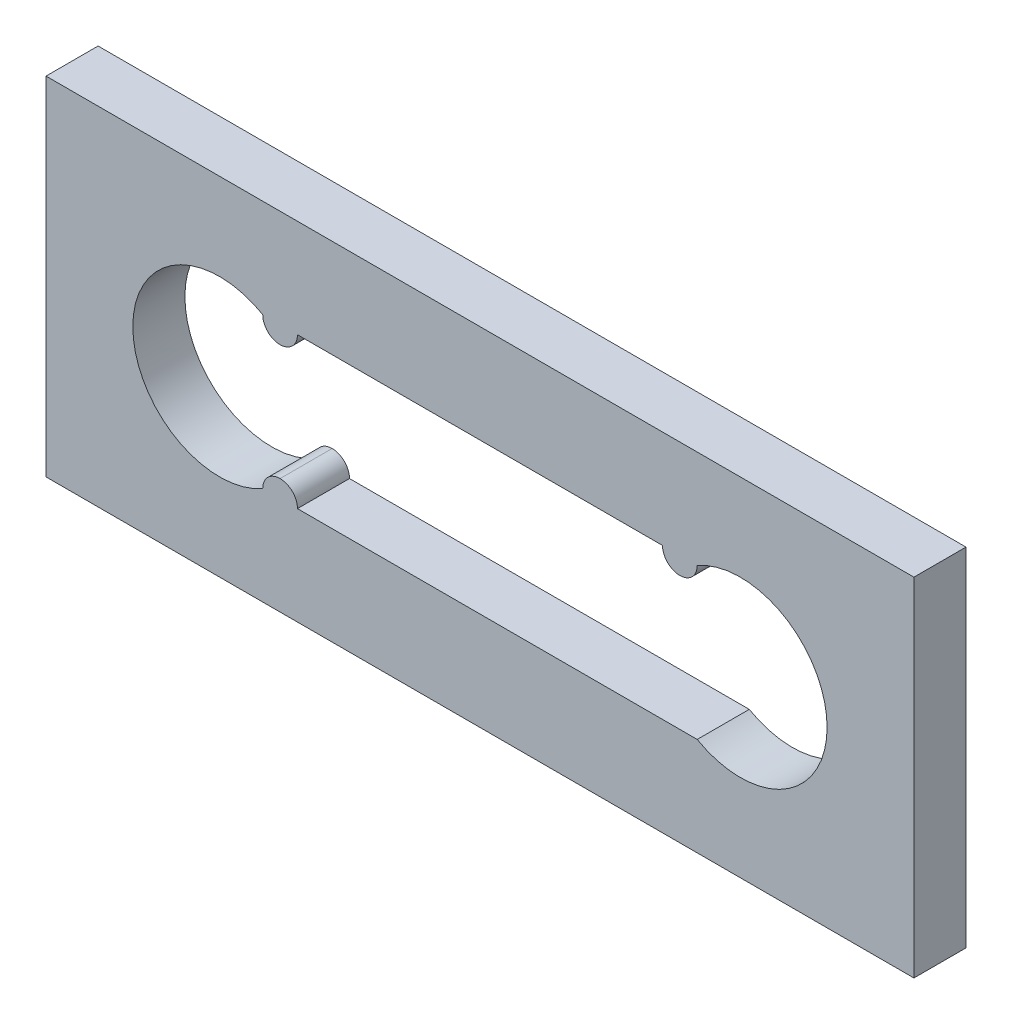
from build123d import *

# Parameters (mm, degrees)
SKETCH_1_W          = 50
SKETCH_1_H          = 20
EXTRUDE_1_DEPTH     = 3
SKETCH_3_R          = 5
SKETCH_3_W          = 30
SKETCH_3_H          = 8.678040074
CUT_EXTRUDE_1_DEPTH = 3
SKETCH_4_W          = 2
SKETCH_4_H          = 3
EXTRUDE_2_DEPTH     = 1
FILLET_1_R          = 1
SKETCH_5_W          = 2
SKETCH_5_H          = 3
EXTRUDE_3_DEPTH     = 1
FILLET_2_R          = 1


with BuildPart() as part:
    # 스케치1 → 보스-돌출1 (new body)
    with BuildSketch(Plane.XY):
        Rectangle(SKETCH_1_W, SKETCH_1_H)
    extrude(amount=-EXTRUDE_1_DEPTH)

    # 스케치3 → 컷-돌출1 (cut)
    with BuildSketch(Plane.XY):
        with Locations((-15, 0)):
            Circle(SKETCH_3_R)
        with Locations((15, 0)):
            Circle(SKETCH_3_R)
        Rectangle(SKETCH_3_W, SKETCH_3_H)
    extrude(amount=-CUT_EXTRUDE_1_DEPTH, mode=Mode.SUBTRACT)

    # 스케치4 → 보스-돌출2 (add)
    with BuildSketch(Plane.XZ.offset(-4.339020037)):
        with Locations((-11.515466821, -1.5)):
            Rectangle(SKETCH_4_W, SKETCH_4_H)
        with Locations((11.515466821, -1.5)):
            Rectangle(SKETCH_4_W, SKETCH_4_H)
    extrude(amount=EXTRUDE_2_DEPTH)

    # 필렛1
    fillet_1_edges = [part.edges().sort_by_distance(p)[0] for p in [
        (12.515466821, 3.339020037, -1.5),
        (10.515466821, 3.339020037, -1.5),
        (-10.515466821, 3.339020037, -1.5),
        (-12.515466821, 3.339020037, -1.5),
    ]]
    fillet(fillet_1_edges, radius=FILLET_1_R - 0.0001)  # a hair under: the kernel refuses the full size

    # 스케치5 → 보스-돌출3 (add)
    with BuildSketch(Plane(origin=(0, -4.339020037, 0), x_dir=(1, 0, 0), z_dir=(0, 1, 0))):
        with Locations((-11.515466821, 1.5)):
            Rectangle(SKETCH_5_W, SKETCH_5_H)
    extrude(amount=EXTRUDE_3_DEPTH)

    # 필렛2
    fillet_2_edges = [part.edges().sort_by_distance(p)[0] for p in [
        (-12.515466821, -3.339020037, -1.5),
        (-10.515466821, -3.339020037, -1.5),
    ]]
    fillet(fillet_2_edges, radius=FILLET_2_R - 0.0001)  # a hair under: the kernel refuses the full size


solid = part.part
